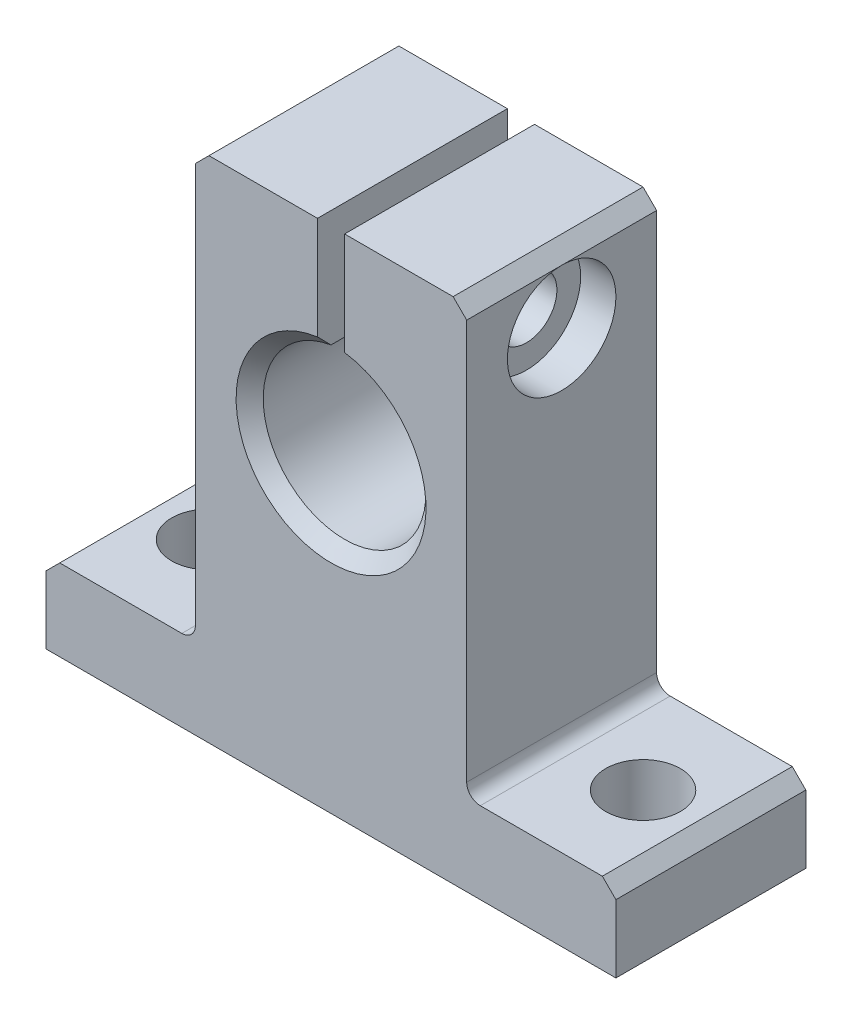
from build123d import *

# Parameters (mm, degrees)
ESTRUSIONE_ESTRUSIONE2_DEPTH                         = 14
FORO_5_5_5_5_3_D                                     = 5.5
FORO_LAMATO_PER_VITE_M4_A_TESTA_CILINDRI_D           = 4.5
FORO_LAMATO_PER_VITE_M4_A_TESTA_CILINDRI_DEPTH       = 9
FORO_LAMATO_PER_VITE_M4_A_TESTA_CILINDRI_CBORE_D     = 8
FORO_LAMATO_PER_VITE_M4_A_TESTA_CILINDRI_CBORE_DEPTH = 2.6
FORO_FILETTATO_M4_1_D                                = 3.3
FORO_FILETTATO_M4_1_CSINK_D                          = 4.05
FORO_FILETTATO_M4_1_CSINK_ANGLE                      = 120
RACCORDO1_R                                          = 1
SMUSSO1_SIZE                                         = 1


with BuildPart() as part:
    # Schizzo10 → Estrusione-Estrusione2 (new body)
    with BuildSketch(Plane.XY):
        with BuildLine():
            Line((21, 0), (-21, 0))
            Line((-21, 0), (-21, 6))
            Line((-21, 6), (-10, 6))
            Line((-10, 6), (-10, 37.5))
            Line((-10, 37.5), (-1, 37.5))
            Line((-1, 37.5), (-1, 28.916079783))
            ThreePointArc((-1, 28.916079783), (0, 17), (1, 28.916079783))
            Line((1, 28.916079783), (1, 37.5))
            Line((1, 37.5), (10, 37.5))
            Line((10, 37.5), (10, 6))
            Line((10, 6), (21, 6))
            Line((21, 6), (21, 0))
        make_face()
    extrude(amount=ESTRUSIONE_ESTRUSIONE2_DEPTH)

    # Foro Ø5.5 (5.5)-3 (through all)
    with Locations(Plane(origin=(0, 6, 0), x_dir=(1, 0, 0), z_dir=(0, 1, 0))):
        with Locations((-16, -7), (16, -7)):
            Hole(FORO_5_5_5_5_3_D / 2)

    # Foro lamato per Vite M4 a testa cilindrica piana-1
    with Locations(Plane(origin=(10, 0, 0), x_dir=(0, 0, -1), z_dir=(1, 0, 0))):
        with Locations((-7, 32.5)):
            CounterBoreHole(FORO_LAMATO_PER_VITE_M4_A_TESTA_CILINDRI_D / 2, FORO_LAMATO_PER_VITE_M4_A_TESTA_CILINDRI_CBORE_D / 2, FORO_LAMATO_PER_VITE_M4_A_TESTA_CILINDRI_CBORE_DEPTH, depth=FORO_LAMATO_PER_VITE_M4_A_TESTA_CILINDRI_DEPTH)

    # Foro filettato M4-1 (through all)
    with Locations(Plane(origin=(-1, 0, 0), x_dir=(0, 0, -1), z_dir=(1, 0, 0))):
        with Locations((-7, 32.5)):
            CounterSinkHole(FORO_FILETTATO_M4_1_D / 2, FORO_FILETTATO_M4_1_CSINK_D / 2, counter_sink_angle=FORO_FILETTATO_M4_1_CSINK_ANGLE)

    # Raccordo1
    raccordo1_edges = [part.edges().sort_by_distance(p)[0] for p in [
        (10, 6, 7),
        (-10, 6, 7),
    ]]
    fillet(raccordo1_edges, radius=RACCORDO1_R)

    # Smusso1
    smusso1_edges = [part.edges().sort_by_distance(p)[0] for p in [
        (0, 17, 0),
        (10, 37.5, 7),
        (21, 6, 7),
        (-21, 6, 7),
        (-10, 37.5, 7),
        (0, 17, 14),
    ]]
    chamfer(smusso1_edges, length=SMUSSO1_SIZE - 0.0001)  # a hair under: the kernel refuses the full size


solid = part.part
